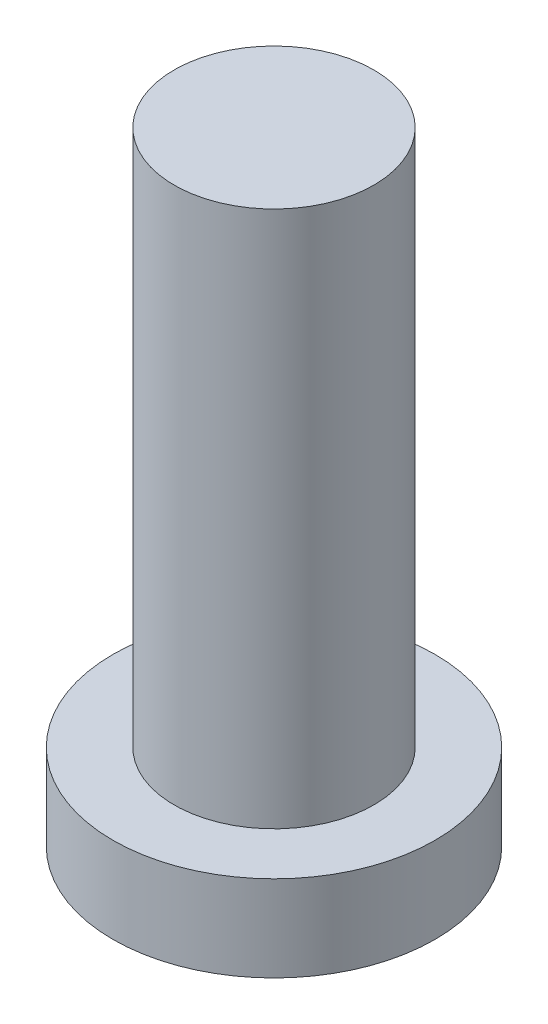
from build123d import *

# Parameters (mm, degrees)
SKETCH1_R           = 7.5
BOSS_EXTRUDE3_DEPTH = 4
SKETCH4_R           = 4.65
BOSS_EXTRUDE4_DEPTH = 21
SKETCH7_R           = 4.65
BOSS_EXTRUDE5_DEPTH = 4


with BuildPart() as part:
    # Sketch1 → Boss-Extrude3 (new body)
    with BuildSketch(Plane(origin=(0, 0, 0), x_dir=(1, 0, 0), z_dir=(0, 1, 0))):
        Circle(SKETCH1_R)
    extrude(amount=BOSS_EXTRUDE3_DEPTH)

    # Sketch4 → Boss-Extrude4 (add)
    with BuildSketch(Plane(origin=(0, 4, 0), x_dir=(1, 0, 0), z_dir=(0, 1, 0))):
        Circle(SKETCH4_R)
    extrude(amount=BOSS_EXTRUDE4_DEPTH)

    # Sketch7 → Boss-Extrude5 (add)
    with BuildSketch(Plane(origin=(0, 25, 0), x_dir=(1, 0, 0), z_dir=(0, 1, 0))):
        Circle(SKETCH7_R)
    extrude(amount=BOSS_EXTRUDE5_DEPTH)


solid = part.part
